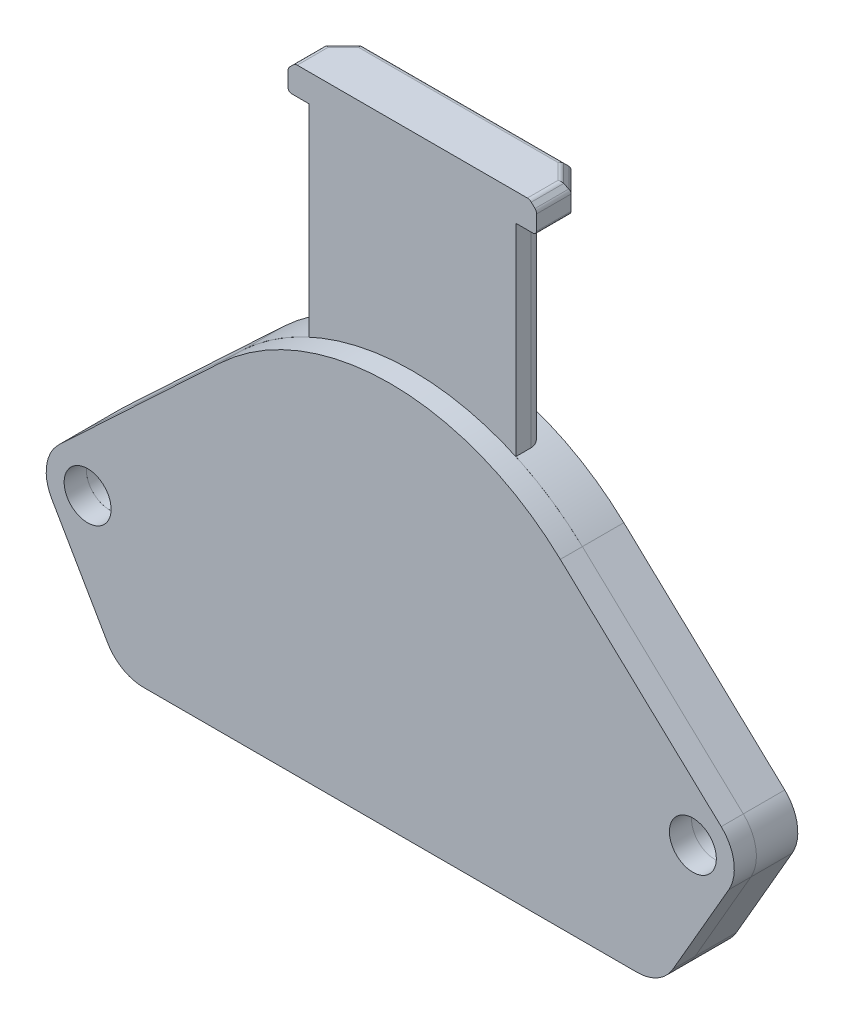
from build123d import *
from OCP.BRepFilletAPI import BRepFilletAPI_MakeChamfer

# Parameters (mm, degrees)
SKETCH1_R           = 1.7
BOSS_EXTRUDE1_DEPTH = 1.6
FILLET3_R           = 3
SKETCH2_R           = 1.7
SKETCH2_W           = 13
SKETCH2_H           = 9.5
BOSS_EXTRUDE2_DEPTH = 3
CHAMFER1_SIZE       = 2
CHAMFER1_SIZE2      = 1.154700538
MOVE_START          = -3
MOVE_FACE2_DEPTH    = 3
MOVE_FACE3_DEPTH    = 3
FILLET2_R           = 1.5
BOSS_EXTRUDE3_START = -3
BOSS_EXTRUDE3_DEPTH = 3
BOSS_EXTRUDE4_START = -3
BOSS_EXTRUDE4_DEPTH = 1
CHAMFER6_SIZE       = 1.5
CHAMFER3_SIZE       = 0.5
FILLET6_R           = 0.4
CHAMFER5_SIZE       = 1.5
FILLET7_R           = 1
FILLET8_R           = 0.25


# Read off the part's stored shape, not the designer's step: Move Face2, Move Face3
with BuildPart() as part:
    # Sketch1 → Boss-Extrude1 (new body)
    with BuildSketch(Plane.XY):
        with BuildLine():
            Line((-12.317518248, 13.12549977), (-23.972919708, 2.187583295))
            ThreePointArc((-23.972919708, 2.187583295), (-24.887744666, 0.438738647), (-24.518076211, -1.5))
            Line((-24.518076211, -1.5), (-19.610598923, -10))
            Line((-19.610598923, -10), (19.610598923, -10))
            Line((19.610598923, -10), (24.518076211, -1.5))
            ThreePointArc((24.518076211, -1.5), (24.887744666, 0.438738647), (23.972919708, 2.187583295))
            Line((23.972919708, 2.187583295), (12.317518248, 13.12549977))
            ThreePointArc((12.317518248, 13.12549977), (0, 18), (-12.317518248, 13.12549977))
        make_face()
        with Locations((-21.92, 0)):
            Circle(SKETCH1_R, mode=Mode.SUBTRACT)
        with Locations((21.92, 0)):
            Circle(SKETCH1_R, mode=Mode.SUBTRACT)
    extrude(amount=BOSS_EXTRUDE1_DEPTH)

    # Fillet3
    fillet3_edges = [part.edges().sort_by_distance(p)[0] for p in [
        (19.610598923, -10, 0.8),
        (-19.610598923, -10, 0.8),
    ]]
    fillet(fillet3_edges, radius=FILLET3_R)


with BuildPart() as body_2:
    # Sketch2 → Boss-Extrude2 (new body)
    with BuildSketch(Plane(origin=(0, 0, 0), x_dir=(-1, 0, 0), z_dir=(0, 0, -1))):
        with BuildLine():
            ThreePointArc((-20.476624327, -8.5), (-19.378548116, -9.598076211), (-17.878548116, -10))
            Line((-17.878548116, -10), (17.878548116, -10))
            ThreePointArc((17.878548116, -10), (19.378548116, -9.598076211), (20.476624327, -8.5))
            Line((20.476624327, -8.5), (24.518076211, -1.5))
            ThreePointArc((24.518076211, -1.5), (24.887744666, 0.438738647), (23.972919708, 2.187583295))
            Line((23.972919708, 2.187583295), (12.317518248, 13.12549977))
            ThreePointArc((12.317518248, 13.12549977), (0, 18), (-12.317518248, 13.12549977))
            Line((-12.317518248, 13.12549977), (-23.972919708, 2.187583295))
            ThreePointArc((-23.972919708, 2.187583295), (-24.887744666, 0.438738647), (-24.518076211, -1.5))
            Line((-24.518076211, -1.5), (-20.476624327, -8.5))
        make_face()
        with BuildLine():
            Line((10.165923783, 4.5), (-10.165923783, 4.5))
            Line((-10.165923783, 4.5), (-14.108909615, 8.701630441))
            Line((-14.108909615, 8.701630441), (-10.948905109, 11.667110906))
            ThreePointArc((-10.948905109, 11.667110906), (0, 16), (10.948905109, 11.667110906))
            Line((10.948905109, 11.667110906), (14.108909615, 8.701630441))
            Line((14.108909615, 8.701630441), (10.165923783, 4.5))
        make_face(mode=Mode.SUBTRACT)
        with BuildLine():
            Line((-16.29649291, 6.648710733), (-9.5, -0.593605806))
            Line((-9.5, -0.593605806), (-9.5, -8))
            Line((-9.5, -8), (-17.72, -8))
            Line((-17.72, -8), (-17.72, 0))
            ThreePointArc((-17.72, 0), (-18.228185683, 2.002625039), (-19.62976526, 3.520628472))
            Line((-19.62976526, 3.520628472), (-16.29649291, 6.648710733))
        make_face(mode=Mode.SUBTRACT)
        with BuildLine():
            Line((17.72, -8), (9.5, -8))
            Line((9.5, -8), (9.5, -0.593605806))
            Line((9.5, -0.593605806), (16.29649291, 6.648710733))
            Line((16.29649291, 6.648710733), (19.62976526, 3.520628472))
            ThreePointArc((19.62976526, 3.520628472), (18.228185683, 2.002625039), (17.72, 0))
            Line((17.72, 0), (17.72, -8))
        make_face(mode=Mode.SUBTRACT)
        with Locations((21.92, 0)):
            Circle(SKETCH2_R, mode=Mode.SUBTRACT)
        with Locations((0, -3.25)):
            Rectangle(SKETCH2_W, SKETCH2_H, mode=Mode.SUBTRACT)
        with Locations((-21.92, 0)):
            Circle(SKETCH2_R, mode=Mode.SUBTRACT)
    extrude(amount=BOSS_EXTRUDE2_DEPTH)

    # Cut-Extrude1 cone 1 section (through the dimple's axis) → Cut-Extrude1 (revolve, cut)
    with BuildSketch(Plane(origin=(-6.85, 13.3, 0), x_dir=(0, -1, 0), z_dir=(1, 0, 0))):
        Polygon((0, 0), (2, 0), (0, 5.494954839), align=None)
    revolve(axis=Axis((-6.85, 13.3, 0), (0, 0, -1)), mode=Mode.SUBTRACT)

    # Cut-Extrude1 cone 2 section (through the dimple's axis) → Cut-Extrude1 cone 2 (revolve, cut)
    with BuildSketch(Plane(origin=(6.85, 13.3, 0), x_dir=(0, -1, 0), z_dir=(1, 0, 0))):
        Polygon((0, 0), (2, 0), (0, 5.494954839), align=None)
    revolve(axis=Axis((6.85, 13.3, 0), (0, 0, -1)), mode=Mode.SUBTRACT)

    # Chamfer1: one chamfer whose edges measure the first distance from different faces: ONE call of the kernel's chamfer builder (chamfer() names one face for all edges)
    chamfer1_edges_1 = [body_2.edges().sort_by_distance(p)[0] for p in [
        (-13.61, -8, 0),
    ]]
    chamfer1_side_1 = [body_2.faces().sort_by_distance(p)[0] for p in [
        (-13.61, -8, -1.5),
    ]]
    chamfer1_edges_2 = [body_2.edges().sort_by_distance(p)[0] for p in [
        (0, -8, 0),
    ]]
    chamfer1_side_2 = [body_2.faces().sort_by_distance(p)[0] for p in [
        (0, -8, -1.5),
    ]]
    chamfer1_edges_3 = [body_2.edges().sort_by_distance(p)[0] for p in [
        (13.61, -8, 0),
    ]]
    chamfer1_side_3 = [body_2.faces().sort_by_distance(p)[0] for p in [
        (13.61, -8, -1.5),
    ]]
    chamfer1 = BRepFilletAPI_MakeChamfer(body_2.part.solid().wrapped)
    for e in chamfer1_edges_1:
        chamfer1.Add(CHAMFER1_SIZE, CHAMFER1_SIZE2, e.wrapped, chamfer1_side_1[0].wrapped)  # the first distance lies on this face
    for e in chamfer1_edges_2:
        chamfer1.Add(CHAMFER1_SIZE, CHAMFER1_SIZE2, e.wrapped, chamfer1_side_2[0].wrapped)  # the first distance lies on this face
    for e in chamfer1_edges_3:
        chamfer1.Add(CHAMFER1_SIZE, CHAMFER1_SIZE2, e.wrapped, chamfer1_side_3[0].wrapped)  # the first distance lies on this face
    add(Compound.cast(chamfer1.Shape()), mode=Mode.REPLACE)

    # Move Face2 outline → Move Face2 (add)
    with BuildSketch(Plane.XY.offset(MOVE_START)):
        with BuildLine():
            Line((-17.72, 0), (-17.72, -0.1726733))
            Line((-17.72, -0.1726733), (-13.559266633, 3.731933007))
            Line((-13.559266633, 3.731933007), (-16.29649291, 6.648710733))
            Line((-16.29649291, 6.648710733), (-19.62976526, 3.520628472))
            ThreePointArc((-19.62976526, 3.520628472), (-18.228185683, 2.002625039), (-17.72, 0))
        make_face()
    extrude(amount=MOVE_FACE2_DEPTH)

    # Move Face3 outline → Move Face3 (add)
    with BuildSketch(Plane.XY.offset(MOVE_START)):
        with BuildLine():
            Line((16.29649291, 6.648710733), (13.559266633, 3.731933007))
            Line((13.559266633, 3.731933007), (17.72, -0.1726733))
            Line((17.72, -0.1726733), (17.72, 0))
            ThreePointArc((17.72, 0), (18.228185683, 2.002625039), (19.62976526, 3.520628472))
            Line((19.62976526, 3.520628472), (16.29649291, 6.648710733))
        make_face()
    extrude(amount=MOVE_FACE3_DEPTH)

    # Fillet2
    fillet2_edges = [body_2.edges().sort_by_distance(p)[0] for p in [
        (9.5, -8.577350269, -1),
        (17.72, -8.577350269, -1),
        (-6.5, -8.577350269, -1),
        (6.5, -8.577350269, -1),
        (-17.72, -8.577350269, -1),
        (-9.5, -8.577350269, -1),
        (-17.72, -0.1726733, -1.5),
        (17.72, -0.1726733, -1.5),
        (-10.165923783, 4.5, -1.5),
        (-14.108909615, 8.701630441, -1.5),
        (14.108909615, 8.701630441, -1.5),
        (10.165923783, 4.5, -1.5),
        (-13.559266633, 3.731933007, -1.5),
        (-9.5, -0.593605806, -1.5),
        (-9.5, -8, -2.5),
        (-17.72, -8, -2.5),
        (6.5, -8, -2.5),
        (-6.5, -8, -2.5),
        (-6.5, 1.5, -1.5),
        (6.5, 1.5, -1.5),
        (17.72, -8, -2.5),
        (9.5, -8, -2.5),
        (9.5, -0.593605806, -1.5),
        (13.559266633, 3.731933007, -1.5),
    ]]
    fillet(fillet2_edges, radius=FILLET2_R)

    # Sketch4 → Boss-Extrude3 (add)
    with BuildSketch(Plane.XY.offset(BOSS_EXTRUDE3_START)):
        with BuildLine():
            ThreePointArc((-7.5, 16.363068172), (0, 18), (7.5, 16.363068172))
            Line((7.5, 16.363068172), (7.5, 31))
            Line((7.5, 31), (9, 31))
            Line((9, 31), (9, 33))
            Line((9, 33), (-9, 33))
            Line((-9, 33), (-9, 31))
            Line((-9, 31), (-7.5, 31))
            Line((-7.5, 31), (-7.5, 16.363068172))
        make_face()
    extrude(amount=BOSS_EXTRUDE3_DEPTH)

    # Sketch4<3> → Boss-Extrude4 (add)
    with BuildSketch(Plane.XY.offset(BOSS_EXTRUDE4_START)):
        Polygon((-7.5, 31), (0, 31), (0, 33), (-9, 33), (-9, 31), align=None)
        Polygon((0, 33), (0, 31), (7.5, 31), (9, 31), (9, 33), align=None)
    extrude(amount=-BOSS_EXTRUDE4_DEPTH)

    # Chamfer6
    chamfer6_edges = [body_2.edges().sort_by_distance(p)[0] for p in [
        (9, 32, -4),
        (-9, 32, -4),
    ]]
    chamfer(chamfer6_edges, length=CHAMFER6_SIZE)

    # Chamfer3
    chamfer3_edges = [body_2.edges().sort_by_distance(p)[0] for p in [
        (0, 33, -4),
        (9, 33, -1.25),
        (-9, 33, -1.25),
        (8.25, 33, -3.25),
        (-8.25, 33, -3.25),
    ]]
    chamfer(chamfer3_edges, length=CHAMFER3_SIZE)

    # Fillet6
    fillet6_edges = [body_2.edges().sort_by_distance(p)[0] for p in [
        (9, 32.5, -1.25),
        (-8.5, 33, -1.146446609),
        (-7.896446609, 33, -2.896446609),
        (0, 33, -3.5),
        (7.896446609, 33, -2.896446609),
        (8.5, 33, -1.146446609),
        (8.25, 32.5, -3.25),
        (0, 32.5, -4),
        (-8.25, 32.5, -3.25),
        (-9, 32.5, -1.25),
    ]]
    fillet(fillet6_edges, radius=FILLET6_R)

    # Chamfer5
    chamfer5_edges = [body_2.edges().sort_by_distance(p)[0] for p in [
        (7.5, 23.681534086, -3),
        (-7.5, 23.681534086, -3),
    ]]
    chamfer(chamfer5_edges, length=CHAMFER5_SIZE)

    # Fillet7
    fillet7_edges = [body_2.edges().sort_by_distance(p)[0] for p in [
        (6, 23.985281374, -3),
        (-6, 23.985281374, -3),
        (7.5, 23.681534086, -1.5),
        (-7.5, 23.681534086, -1.5),
    ]]
    fillet(fillet7_edges, radius=FILLET7_R)

    # Fillet8
    fillet8_edges = [body_2.edges().sort_by_distance(p)[0] for p in [
        (0, 31, -4),
        (-9, 31, -1.25),
        (9, 31, -1.25),
        (8.25, 31, -3.25),
        (-8.25, 31, -3.25),
    ]]
    fillet(fillet8_edges, radius=FILLET8_R)


solid = Compound([part.part, body_2.part])
